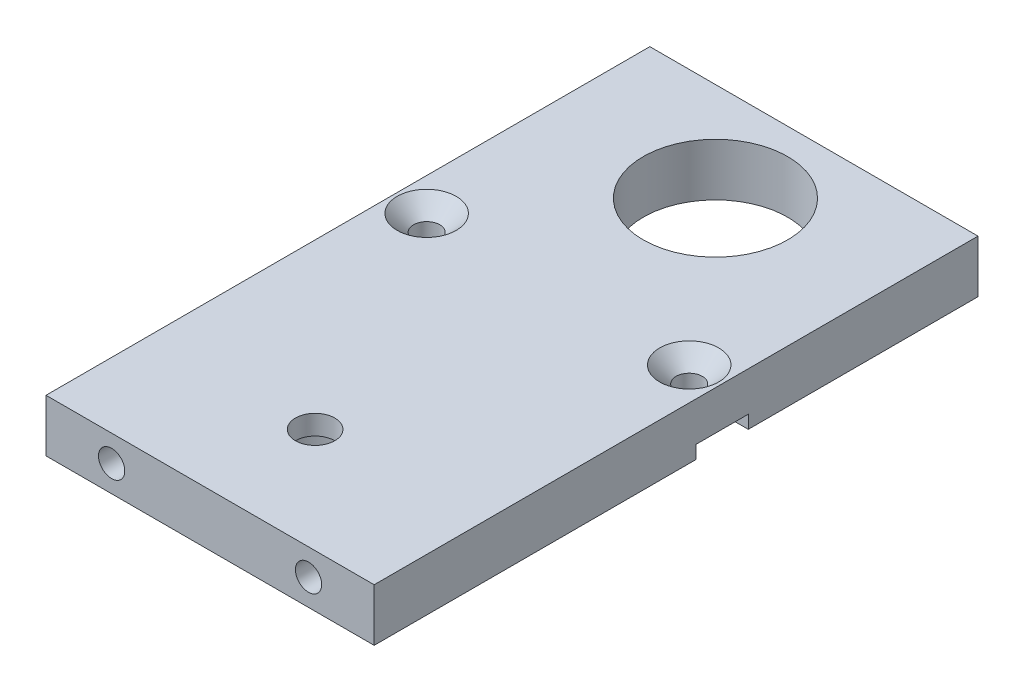
from build123d import *

# Parameters (mm, degrees)
ESQUISSE1_W             = 50
ESQUISSE1_H             = 92
ESQUISSE1_R             = 11
ESQUISSE1_R_2           = 2
BOSS_EXTRU_1_DEPTH      = 8
CHANFREIN1_SIZE         = 2.5
ESQUISSE2_R             = 2
ENL_V_MAT_EXTRU_1_DEPTH = 10
ESQUISSE3_R             = 8
ENL_V_MAT_EXTRU_2_DEPTH = 5
ESQUISSE4_R             = 3
ENL_V_MAT_EXTRU_3_DEPTH = 79.852413099
ESQUISSE5_W             = 50
ESQUISSE5_H             = 8
ENL_V_MAT_EXTRU_4_DEPTH = 2


with BuildPart() as part:
    # Esquisse1 → Boss.-Extru.1 (new body)
    with BuildSketch(Plane(origin=(0, 0, 0), x_dir=(1, 0, 0), z_dir=(0, 1, 0))):
        with Locations((-6.491408935, -26.117918819)):
            Rectangle(ESQUISSE1_W, ESQUISSE1_H)
        with Locations((-6.491408935, 4.882081181)):
            Circle(ESQUISSE1_R, mode=Mode.SUBTRACT)
        with Locations((-26.491408935, -19.117918819)):
            Circle(ESQUISSE1_R_2, mode=Mode.SUBTRACT)
        with Locations((13.508591065, -19.117918819)):
            Circle(ESQUISSE1_R_2, mode=Mode.SUBTRACT)
    extrude(amount=BOSS_EXTRU_1_DEPTH)

    # Chanfrein1
    chanfrein1_edges = [part.edges().sort_by_distance(p)[0] for p in [
        (11.508591065, 8, 19.117918819),
        (-28.491408935, 8, 19.117918819),
    ]]
    chamfer(chanfrein1_edges, length=CHANFREIN1_SIZE)

    # Esquisse2 → Enlèv. mat.-Extru.1 (cut)
    with BuildSketch(Plane.XY.offset(72.117918819)):
        with Locations((-21.491408935, 4)):
            Circle(ESQUISSE2_R)
        with Locations((8.508591065, 4)):
            Circle(ESQUISSE2_R)
    extrude(amount=-ENL_V_MAT_EXTRU_1_DEPTH, mode=Mode.SUBTRACT)

    # Esquisse3 → Enlèv. mat.-Extru.2 (cut)
    with BuildSketch(Plane.XZ):
        with Locations((-6.491408935, 56.117918819)):
            Circle(ESQUISSE3_R)
    extrude(amount=-ENL_V_MAT_EXTRU_2_DEPTH, mode=Mode.SUBTRACT)

    # Esquisse4 → Enlèv. mat.-Extru.3 (cut, through all)
    with BuildSketch(Plane.XZ.offset(-5)):
        with Locations((-6.491408935, 56.117918819)):
            Circle(ESQUISSE4_R)
    extrude(amount=-ENL_V_MAT_EXTRU_3_DEPTH, mode=Mode.SUBTRACT)

    # Esquisse5 → Enlèv. mat.-Extru.4 (cut)
    with BuildSketch(Plane.XZ):
        with Locations((-6.491408935, 19.117918819)):
            Rectangle(ESQUISSE5_W, ESQUISSE5_H)
    extrude(amount=-ENL_V_MAT_EXTRU_4_DEPTH, mode=Mode.SUBTRACT)


solid = part.part
